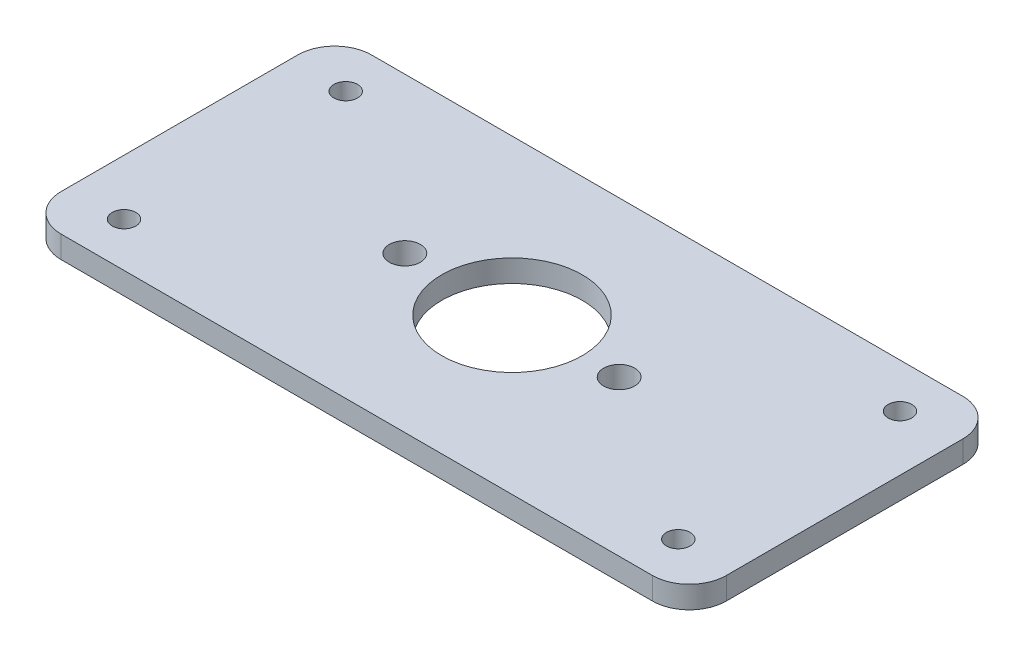
from build123d import *

# Parameters (mm, degrees)
SKETCH1_W           = 90
SKETCH1_H           = 42
SKETCH1_R           = 9.5
SKETCH1_R_2         = 2.1
SKETCH1_R_3         = 1.6
BOSS_EXTRUDE1_DEPTH = 3
FILLET1_R           = 5


with BuildPart() as part:
    # Sketch1 → Boss-Extrude1 (new body)
    with BuildSketch(Plane(origin=(0, 0, 0), x_dir=(1, 0, 0), z_dir=(0, 1, 0))):
        with Locations((45, 21)):
            Rectangle(SKETCH1_W, SKETCH1_H)
        with Locations((45, 21)):
            Circle(SKETCH1_R, mode=Mode.SUBTRACT)
        with Locations((59.5, 21)):
            Circle(SKETCH1_R_2, mode=Mode.SUBTRACT)
        with Locations((30.5, 21)):
            Circle(SKETCH1_R_2, mode=Mode.SUBTRACT)
        with Locations((7.5, 36)):
            Circle(SKETCH1_R_3, mode=Mode.SUBTRACT)
        with Locations((7.5, 6)):
            Circle(SKETCH1_R_3, mode=Mode.SUBTRACT)
        with Locations((82.5, 6)):
            Circle(SKETCH1_R_3, mode=Mode.SUBTRACT)
        with Locations((82.5, 36)):
            Circle(SKETCH1_R_3, mode=Mode.SUBTRACT)
    extrude(amount=BOSS_EXTRUDE1_DEPTH)

    # Fillet1
    fillet1_edges = [part.edges().sort_by_distance(p)[0] for p in [
        (90, 1.5, -42),
        (90, 1.5, 0),
        (0, 1.5, 0),
        (0, 1.5, -42),
    ]]
    fillet(fillet1_edges, radius=FILLET1_R)


solid = part.part
